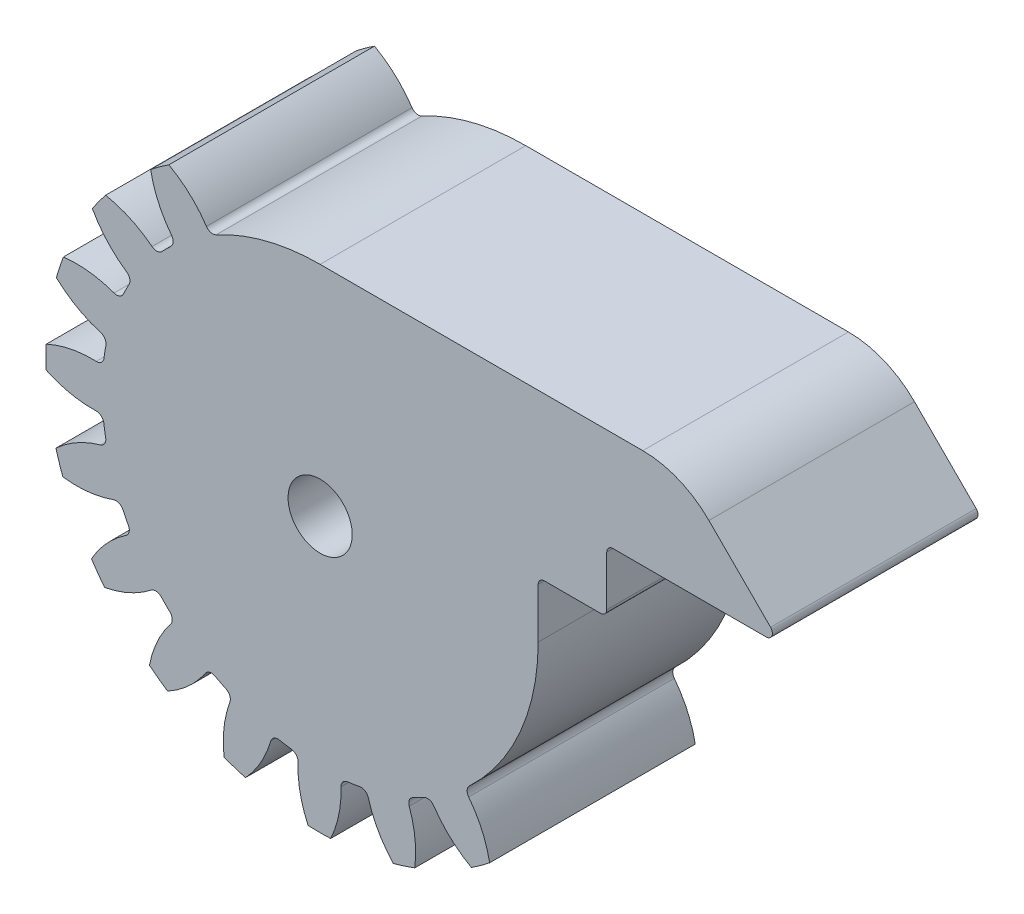
from build123d import *
from build123d.topology import SkipClean

# Parameters (mm, degrees)
SKBASE_R                                = 22
BASE_DEPTH                              = 8.25
TOOTHPROFILE_DEPTH                      = 33.187924754
FILLETTOOTHPROFILE_R                    = 0.6
CIRPATTERNTEETH_COUNT                   = 20
FILLETTOOTHPROFILE_OF_CIRPATTERNTEETH_R = 0.6
SKCHAVETA_R                             = 2.575
CHAVETA_DEPTH                           = 36.032658713
BODY_MOVE_COPY1_ANGLE                   = 8.84
CUT_EXTRUDE1_START                      = -16.5
CUT_EXTRUDE1_DEPTH                      = 16.5
BOSS_EXTRUDE1_START                     = -16.5
BOSS_EXTRUDE1_DEPTH                     = 16.5
SKETCH10_R                              = 5
SKETCH10_R_2                            = 2.575
BOSS_EXTRUDE2_DEPTH                     = 1.65
FILLET1_R                               = 0.5
FILLET2_R                               = 7.5


with BuildPart() as part:
    # skBase → Base (new, symmetric)
    with BuildSketch(Plane.XY):
        Circle(SKBASE_R)
    extrude(amount=BASE_DEPTH, both=True)

    # skToothProfile → ToothProfile (cut, symmetric)
    with BuildSketch(Plane.XY):
        with BuildLine():
            ThreePointArc((-1.056260379, 17.468094172), (-1.711312383, 20.303280592), (-3.25795804, 22.768085326))
            ThreePointArc((-3.25795804, 22.768085326), (0, 23), (3.25795804, 22.768085326))
            ThreePointArc((3.25795804, 22.768085326), (1.711312383, 20.303280592), (1.056260379, 17.468094172))
            ThreePointArc((1.056260379, 17.468094172), (0, 17.5), (-1.056260379, 17.468094172))
        make_face()
    toothprofile = extrude(amount=TOOTHPROFILE_DEPTH, both=True, mode=Mode.SUBTRACT)

    # FilletToothProfile
    fillettoothprofile_edges = [part.edges().sort_by_distance(p)[0] for p in [
        (1.056260379, 17.468094172, 0),
        (-1.056260379, 17.468094172, 0),
    ]]
    fillet(fillettoothprofile_edges, radius=FILLETTOOTHPROFILE_R)

    # CirPatternTeeth: ToothProfile ×20 about axis
    cirpatternteeth_axis = Axis((0, 0, 8.25), (0, 0, 1))
    for i in range(1, CIRPATTERNTEETH_COUNT):
        add(toothprofile.rotate(cirpatternteeth_axis, i * 360 / CIRPATTERNTEETH_COUNT), mode=Mode.SUBTRACT)

    # FilletToothProfile of CirPatternTeeth
    fillettoothprofile_of_cirpatternteeth_edges = [part.edges().sort_by_distance(p)[0] for p in [
        (-4.393374642, 16.939547198, 0),
        (-6.402501275, 16.286742382, 0),
        (-9.412955543, 14.752839318, 0),
        (-11.122020738, 13.511130771, 0),
        (-13.511130771, 11.122020738, 0),
        (-14.752839318, 9.412955543, 0),
        (-16.286742382, 6.402501275, 0),
        (-16.939547198, 4.393374642, 0),
        (-17.468094172, 1.056260379, 0),
        (-17.468094172, -1.056260379, 0),
        (-16.939547198, -4.393374642, 0),
        (-16.286742382, -6.402501275, 0),
        (-14.752839318, -9.412955543, 0),
        (-13.511130771, -11.122020738, 0),
        (-11.122020738, -13.511130771, 0),
        (-9.412955543, -14.752839318, 0),
        (-6.402501275, -16.286742382, 0),
        (-4.393374642, -16.939547198, 0),
        (-1.056260379, -17.468094172, 0),
        (1.056260379, -17.468094172, 0),
        (4.393374642, -16.939547198, 0),
        (6.402501275, -16.286742382, 0),
        (9.412955543, -14.752839318, 0),
        (11.122020738, -13.511130771, 0),
        (13.511130771, -11.122020738, 0),
        (14.752839318, -9.412955543, 0),
        (16.286742382, -6.402501275, 0),
        (16.939547198, -4.393374642, 0),
        (17.468094172, -1.056260379, 0),
        (17.468094172, 1.056260379, 0),
        (16.939547198, 4.393374642, 0),
        (16.286742382, 6.402501275, 0),
        (14.752839318, 9.412955543, 0),
        (13.511130771, 11.122020738, 0),
        (11.122020738, 13.511130771, 0),
        (9.412955543, 14.752839318, 0),
        (6.402501275, 16.286742382, 0),
        (4.393374642, 16.939547198, 0),
    ]]
    fillet(fillettoothprofile_of_cirpatternteeth_edges, radius=FILLETTOOTHPROFILE_OF_CIRPATTERNTEETH_R)

    # skChaveta → Chaveta (cut, through all)
    with BuildSketch(Plane.XY.offset(8.25)):
        Circle(SKCHAVETA_R)
    extrude(amount=-CHAVETA_DEPTH, mode=Mode.SUBTRACT)


with BuildPart() as part_1:
    # Body-Move/Copy1: moved
    add(part.part.rotate(Axis((0, 0, 0), (0, 0, 1)), BODY_MOVE_COPY1_ANGLE))

    # Sketch7 → Cut-Extrude1 (cut)
    with BuildSketch(Plane(origin=(0, 0, -8.25), x_dir=(-1, 0, 0), z_dir=(0, 0, -1)).offset(CUT_EXTRUDE1_START)):
        with BuildLine():
            ThreePointArc((3.177021559, 17.20919911), (5.361298987, 16.65852554), (7.456744124, 15.831833977))
            ThreePointArc((7.456744124, 15.831833977), (7.158104529, 16.144961281), (7.147753456, 16.577543263))
            ThreePointArc((7.147753456, 16.577543263), (7.612057292, 18.586093838), (7.594681004, 20.647537878))
            ThreePointArc((7.594681004, 20.647537878), (6.739918727, 20.942146393), (5.873773607, 21.201386361))
            ThreePointArc((5.873773607, 21.201386361), (4.657305951, 19.537036665), (3.862951402, 17.634708009))
            ThreePointArc((3.862951402, 17.634708009), (3.602236584, 17.289364557), (3.177021559, 17.20919911))
        make_face()
        with BuildLine():
            ThreePointArc((-2.296407928, 17.348674607), (-0.048869156, 17.499931766), (2.199479339, 17.361229526))
            ThreePointArc((2.199479339, 17.361229526), (1.818694547, 17.566746578), (1.675174908, 17.974957834))
            ThreePointArc((1.675174908, 17.974957834), (1.496077835, 20.028680723), (0.842530762, 21.983860942))
            ThreePointArc((0.842530762, 21.983860942), (-0.06143551, 21.99991422), (-0.965298025, 21.978812518))
            ThreePointArc((-0.965298025, 21.978812518), (-1.607915176, 20.020012717), (-1.775539362, 17.965321597))
            ThreePointArc((-1.775539362, 17.965321597), (-1.916776894, 17.556315147), (-2.296407928, 17.348674607))
        make_face()
        with BuildLine():
            ThreePointArc((-7.545049008, 15.789940958), (-5.454253645, 16.628322741), (-3.273085809, 17.191186966))
            ThreePointArc((-3.273085809, 17.191186966), (-3.698741928, 17.268976326), (-3.961381432, 17.612858293))
            ThreePointArc((-3.961381432, 17.612858293), (-4.766348144, 19.51072079), (-5.992092262, 21.168250526))
            ThreePointArc((-5.992092262, 21.168250526), (-6.856776011, 20.90417716), (-7.709879561, 20.604799372))
            ThreePointArc((-7.709879561, 20.604799372), (-7.715742363, 18.543290436), (-7.240227963, 16.537364335))
            ThreePointArc((-7.240227963, 16.537364335), (-7.248162894, 16.104731288), (-7.545049008, 15.789940958))
        make_face()
        with BuildLine():
            ThreePointArc((-12.055128121, 12.685577874), (-10.325737785, 14.12901763), (-8.425258513, 15.338351247))
            ThreePointArc((-8.425258513, 15.338351247), (-8.854119773, 15.280798351), (-9.210170156, 15.526689467))
            ThreePointArc((-9.210170156, 15.526689467), (-10.562210758, 17.082915568), (-12.240167545, 18.28054426))
            ThreePointArc((-12.240167545, 18.28054426), (-12.980927502, 17.762193592), (-13.699764368, 17.2138449))
            ThreePointArc((-13.699764368, 17.2138449), (-13.068298928, 15.251421688), (-11.996192606, 13.490614629))
            ThreePointArc((-11.996192606, 13.490614629), (-11.870048209, 13.076704123), (-12.055128121, 12.685577874))
        make_face()
        with BuildLine():
            ThreePointArc((-15.385167301, 8.339462041), (-14.186466768, 10.246665831), (-12.752708211, 11.98409084))
            ThreePointArc((-12.752708211, 11.98409084), (-13.142794684, 11.796829366), (-13.557403255, 11.920660095))
            ThreePointArc((-13.557403255, 11.920660095), (-15.324170592, 12.982915545), (-17.290089948, 13.603410955))
            ThreePointArc((-17.290089948, 13.603410955), (-17.834415365, 12.881522759), (-18.348620787, 12.137879354))
            ThreePointArc((-18.348620787, 12.137879354), (-17.141639343, 10.466637523), (-15.577886333, 9.123309569))
            ThreePointArc((-15.577886333, 9.123309569), (-15.330010503, 8.768638047), (-15.385167301, 8.339462041))
        make_face()
        with BuildLine():
            ThreePointArc((-13.490614629, -11.996192606), (-13.076704123, -11.870048209), (-12.685577874, -12.055128121))
            ThreePointArc((-12.685577874, -12.055128121), (-14.12901763, -10.325737785), (-15.338351247, -8.425258513))
            ThreePointArc((-15.338351247, -8.425258513), (-15.280798351, -8.854119773), (-15.526689467, -9.210170156))
            ThreePointArc((-15.526689467, -9.210170156), (-17.082915568, -10.562210758), (-18.28054426, -12.240167545))
            ThreePointArc((-18.28054426, -12.240167545), (-17.762193592, -12.980927502), (-17.2138449, -13.699764368))
            ThreePointArc((-17.2138449, -13.699764368), (-15.251421688, -13.068298928), (-13.490614629, -11.996192606))
        make_face()
        with BuildLine():
            ThreePointArc((-17.20919911, 3.177021559), (-16.65852554, 5.361298987), (-15.831833977, 7.456744124))
            ThreePointArc((-15.831833977, 7.456744124), (-16.144961281, 7.158104529), (-16.577543263, 7.147753456))
            ThreePointArc((-16.577543263, 7.147753456), (-18.586093838, 7.612057292), (-20.647537878, 7.594681004))
            ThreePointArc((-20.647537878, 7.594681004), (-20.942146393, 6.739918727), (-21.201386361, 5.873773607))
            ThreePointArc((-21.201386361, 5.873773607), (-19.537036665, 4.657305951), (-17.634708009, 3.862951402))
            ThreePointArc((-17.634708009, 3.862951402), (-17.289364557, 3.602236584), (-17.20919911, 3.177021559))
        make_face()
        with BuildLine():
            ThreePointArc((-16.537364335, -7.240227963), (-16.104731288, -7.248162894), (-15.789940958, -7.545049008))
            ThreePointArc((-15.789940958, -7.545049008), (-16.628322741, -5.454253645), (-17.191186966, -3.273085809))
            ThreePointArc((-17.191186966, -3.273085809), (-17.268976326, -3.698741928), (-17.612858293, -3.961381432))
            ThreePointArc((-17.612858293, -3.961381432), (-19.51072079, -4.766348144), (-21.168250526, -5.992092262))
            ThreePointArc((-21.168250526, -5.992092262), (-20.90417716, -6.856776011), (-20.604799372, -7.709879561))
            ThreePointArc((-20.604799372, -7.709879561), (-18.543290436, -7.715742363), (-16.537364335, -7.240227963))
        make_face()
        with BuildLine():
            ThreePointArc((-17.348674607, -2.296407928), (-17.499931766, -0.048869156), (-17.361229526, 2.199479339))
            ThreePointArc((-17.361229526, 2.199479339), (-17.566746578, 1.818694547), (-17.974957834, 1.675174908))
            ThreePointArc((-17.974957834, 1.675174908), (-20.028680723, 1.496077835), (-21.983860942, 0.842530762))
            ThreePointArc((-21.983860942, 0.842530762), (-21.99991422, -0.06143551), (-21.978812518, -0.965298025))
            ThreePointArc((-21.978812518, -0.965298025), (-20.020012717, -1.607915176), (-17.965321597, -1.775539362))
            ThreePointArc((-17.965321597, -1.775539362), (-17.556315147, -1.916776894), (-17.348674607, -2.296407928))
        make_face()
    extrude(amount=CUT_EXTRUDE1_DEPTH, mode=Mode.SUBTRACT)

    # Sketch9 → Boss-Extrude1 (add)
    with BuildSketch(Plane(origin=(0, 0, -8.25), x_dir=(-1, 0, 0), z_dir=(0, 0, -1)).offset(BOSS_EXTRUDE1_START)):
        with BuildLine():
            Line((-17.5, 0), (-17.5, 4.5))
            Line((-17.5, 4.5), (-23, 4.5))
            Line((-23, 4.5), (-23, 9.5))
            Line((-23, 9.5), (-37, 9.5))
            Line((-37, 9.5), (-29, 17.5))
            Line((-29, 17.5), (0, 17.5))
            ThreePointArc((0, 17.5), (-12.374368671, 12.374368671), (-17.5, 0))
        make_face()
    extrude(amount=BOSS_EXTRUDE1_DEPTH)

    # Sketch10 → Boss-Extrude2 (add)
    with SkipClean():  # the faces are left unmerged after this step: merging them gives an invalid solid
        with BuildSketch(Plane(origin=(0, 0, -8.25), x_dir=(-1, 0, 0), z_dir=(0, 0, -1))):
            Circle(SKETCH10_R)
            Circle(SKETCH10_R_2, mode=Mode.SUBTRACT)
        extrude(amount=BOSS_EXTRUDE2_DEPTH)
    add(part_1.part.scale(1), mode=Mode.REPLACE)  # the faces are merged on a copy

    # Fillet1
    fillet1_edges = [part_1.edges().sort_by_distance(p)[0] for p in [
        (17.5, 4.5, 0),
        (23, 4.5, 0),
        (23, 9.5, 0),
        (37, 9.5, 0),
    ]]
    fillet(fillet1_edges, radius=FILLET1_R)

    # Fillet2
    fillet2_edges = [part_1.edges().sort_by_distance(p)[0] for p in [
        (29, 17.5, 0),
    ]]
    fillet(fillet2_edges, radius=FILLET2_R)


solid = part_1.part
